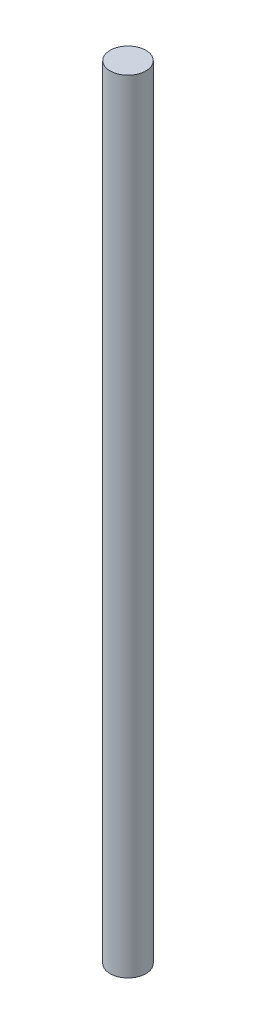
from build123d import *

# Parameters (mm, degrees)
SKETCH1_R           = 2
BOSS_EXTRUDE1_DEPTH = 87.5


with BuildPart() as part:
    # Sketch1 → Boss-Extrude1 (new body)
    with BuildSketch(Plane(origin=(0, 0, 0), x_dir=(1, 0, 0), z_dir=(0, 1, 0))):
        Circle(SKETCH1_R)
    extrude(amount=BOSS_EXTRUDE1_DEPTH)


solid = part.part
